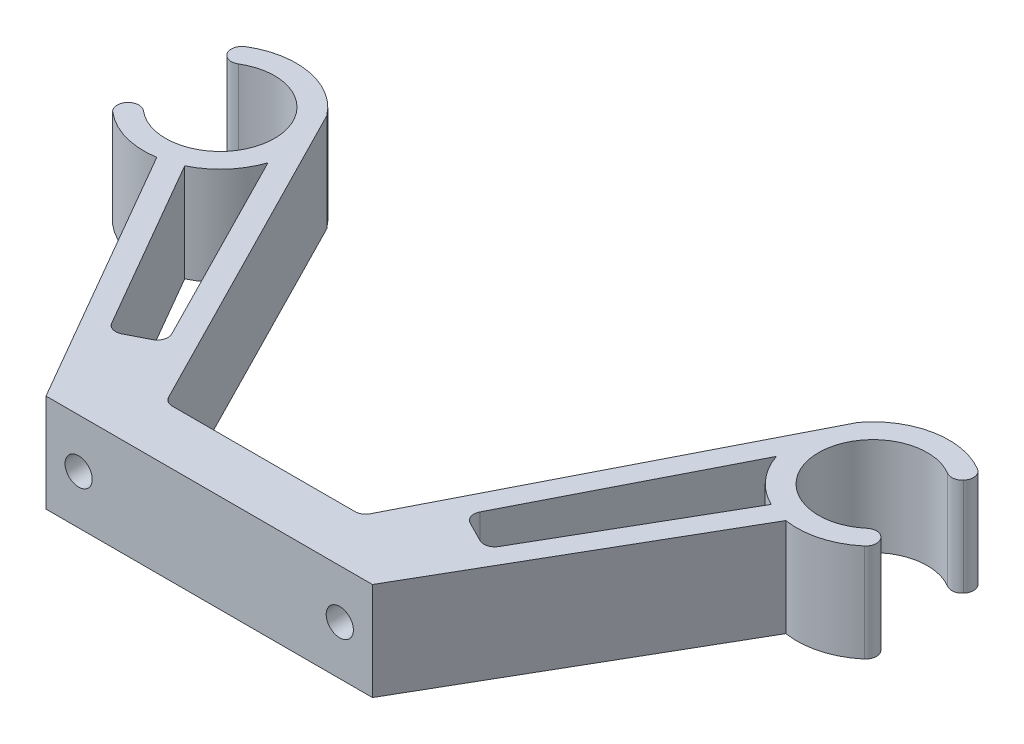
from build123d import *

# Parameters (mm, degrees)
BOSS_EXTRUDE1_DEPTH = 9
FILLET3_R           = 1
SKETCH2_R           = 1.25
CUT_EXTRUDE1_DEPTH  = 3


with BuildPart() as part:
    # Sketch1 → Boss-Extrude1 (new body)
    with BuildSketch(Plane(origin=(0, 0, 0), x_dir=(1, 0, 0), z_dir=(0, 1, 0))):
        with BuildLine():
            Line((-15, 0), (15, 0))
            Line((15, 0), (28.906062556, 24.08600688))
            ThreePointArc((28.906062556, 24.08600688), (32.451975053, 24.443490384), (35.362311102, 26.500486732))
            Line((35.362311102, 26.500486732), (33.830222216, 27.786061952))
            ThreePointArc((33.830222216, 27.786061952), (25.016172377, 30.598176376), (33.265843673, 34.786061952))
            Line((33.265843673, 34.786061952), (34.572181143, 36.300486732))
            ThreePointArc((34.572181143, 36.300486732), (29.254107826, 37.9601469), (24.408479197, 35.211281884))
            Line((24.408479197, 35.211281884), (9, 5))
            Line((9, 5), (-9, 5))
            Line((-9, 5), (-24.408479197, 35.211281884))
            ThreePointArc((-24.408479197, 35.211281884), (-29.254107826, 37.9601469), (-34.572181143, 36.300486732))
            Line((-34.572181143, 36.300486732), (-33.265843673, 34.786061952))
            ThreePointArc((-33.265843673, 34.786061952), (-25.016172377, 30.598176376), (-33.830222216, 27.786061952))
            Line((-33.830222216, 27.786061952), (-35.362311102, 26.500486732))
            ThreePointArc((-35.362311102, 26.500486732), (-32.451975053, 24.443490384), (-28.906062556, 24.08600688))
            Line((-28.906062556, 24.08600688), (-15, 0))
        make_face()
        with BuildLine():
            Line((13.711166355, 9.835186109), (23.366165954, 28.765666577))
            ThreePointArc((23.366165954, 28.765666577), (24.748776454, 26.371322946), (26.950630684, 24.699099527))
            Line((26.950630684, 24.699099527), (17.309401077, 8))
            Line((17.309401077, 8), (13.711166355, 9.835186109))
        make_face(mode=Mode.SUBTRACT)
        with BuildLine():
            Line((-17.309401077, 8), (-13.711166355, 9.835186109))
            Line((-13.711166355, 9.835186109), (-23.366165954, 28.765666577))
            ThreePointArc((-23.366165954, 28.765666577), (-24.748776454, 26.371322946), (-26.950630684, 24.699099527))
            Line((-26.950630684, 24.699099527), (-17.309401077, 8))
        make_face(mode=Mode.SUBTRACT)
    extrude(amount=BOSS_EXTRUDE1_DEPTH)

    # Fillet3
    fillet3_edges = [part.edges().sort_by_distance(p)[0] for p in [
        (-33.265843673, 4.5, -34.786061952),
        (-34.572181143, 4.5, -36.300486732),
        (-33.830222216, 4.5, -27.786061952),
        (-35.362311102, 4.5, -26.500486732),
        (-17.309401077, 4.5, -8),
        (-13.711166355, 4.5, -9.835186109),
        (17.309401077, 4.5, -8),
        (13.711166355, 4.5, -9.835186109),
        (33.265843673, 4.5, -34.786061952),
        (34.572181143, 4.5, -36.300486732),
        (33.830222216, 4.5, -27.786061952),
        (35.362311102, 4.5, -26.500486732),
        (-9, 4.5, -5),
        (9, 4.5, -5),
    ]]
    fillet(fillet3_edges, radius=FILLET3_R - 0.0001)  # a hair under: the kernel refuses the full size

    # Sketch2 → Cut-Extrude1 (cut)
    with BuildSketch(Plane.XY):
        with Locations((-12, 4.5)):
            Circle(SKETCH2_R)
        with Locations((12, 4.5)):
            Circle(SKETCH2_R)
    extrude(amount=-CUT_EXTRUDE1_DEPTH, mode=Mode.SUBTRACT)


solid = part.part
